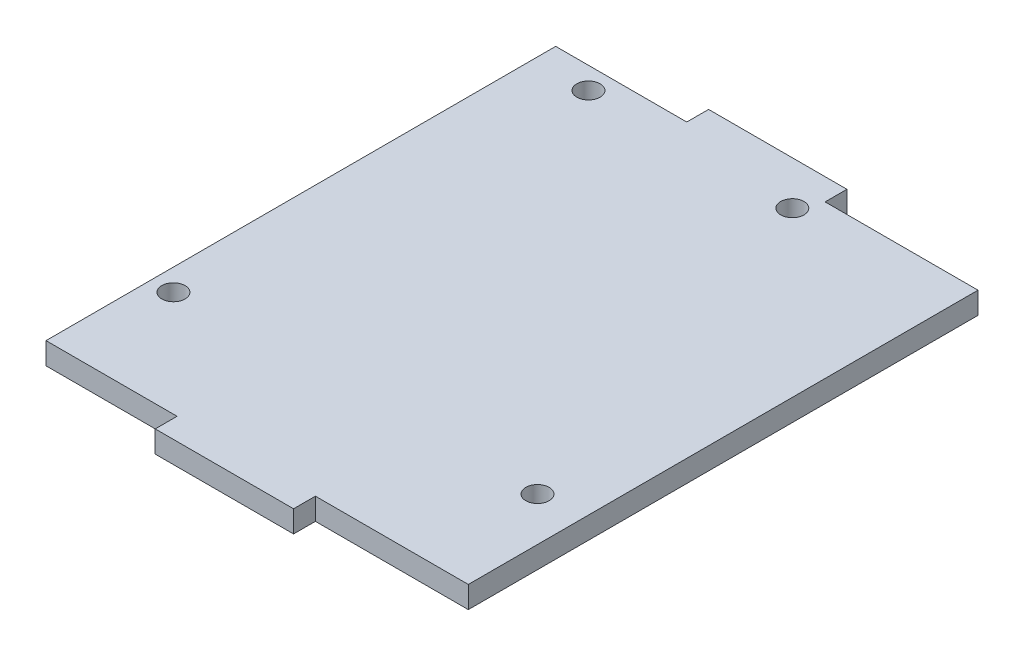
from build123d import *

# Parameters (mm, degrees)
SKETCH1_R           = 1.6
BOSS_EXTRUDE1_DEPTH = 3


with BuildPart() as part:
    # Sketch1 → Boss-Extrude1 (new body)
    with BuildSketch(Plane(origin=(0, 0, 0), x_dir=(1, 0, 0), z_dir=(0, 1, 0))):
        Polygon((3, -35), (21, -35), (21, -38), (40, -38), (40, -35), (61, -35), (61, 35), (40, 35), (40, 38), (21, 38), (21, 35), (3, 35), align=None)
        with Locations((6, -20.5)):
            Circle(SKETCH1_R, mode=Mode.SUBTRACT)
        with Locations((55, -19.5)):
            Circle(SKETCH1_R, mode=Mode.SUBTRACT)
        with Locations((10.5, 32)):
            Circle(SKETCH1_R, mode=Mode.SUBTRACT)
        with Locations((38.5, 32)):
            Circle(SKETCH1_R, mode=Mode.SUBTRACT)
    extrude(amount=BOSS_EXTRUDE1_DEPTH)


solid = part.part
